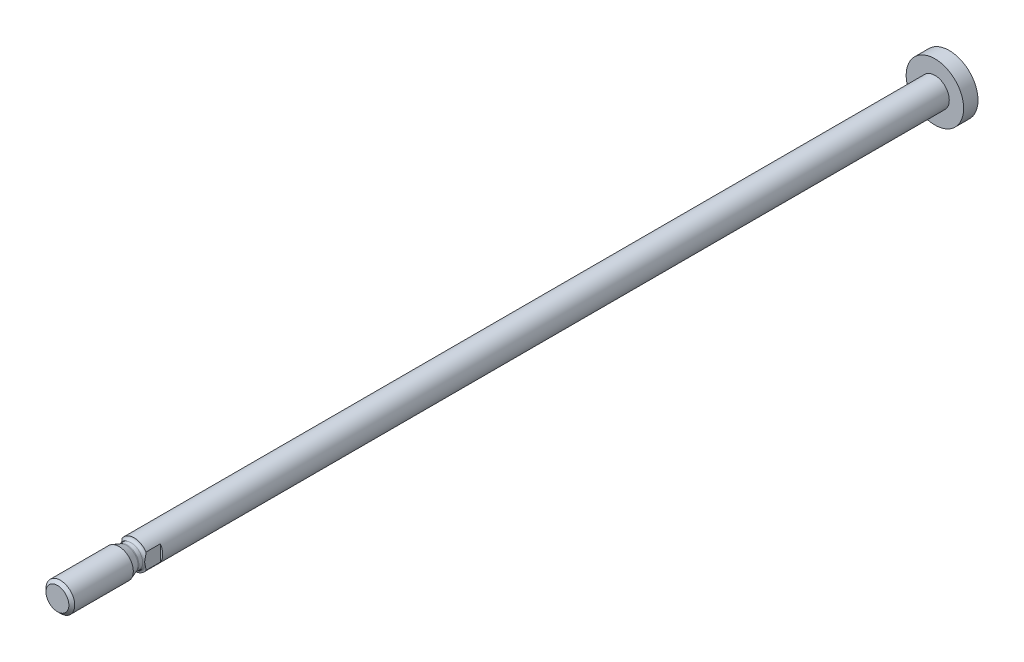
from build123d import *

# Parameters (mm, degrees)
SCHNITT_LINEAR_AUSTRAGEN1_DEPTH = 4


with BuildPart() as part:
    # Skizze1 → Rotation1 (revolve)
    with BuildSketch(Plane(origin=(0, 0, 0), x_dir=(0, 0, -1), z_dir=(1, 0, 0))):
        Polygon((-5, 0), (-5, 3), (162.3, 3), (162.3, 6), (165.3, 6), (165.3, 0), align=None)
    revolve(axis=Axis((0, 0, -165.3), (0, 0, 1)))

    # Skizze2 → Rotation2 (revolve)
    with BuildSketch(Plane(origin=(0, 0, 0), x_dir=(0, 0, -1), z_dir=(1, 0, 0))):
        with BuildLine():
            Line((-21, 0), (-21, 2.3865))
            Line((-21, 2.3865), (-20.3865, 3))
            Line((-20.3865, 3), (-8.148486452, 3))
            Line((-8.148486452, 3), (-6.599415898, 2.436184428))
            ThreePointArc((-6.599415898, 2.436184428), (-6.498392718, 2.409115348), (-6.394203812, 2.4))
            Line((-6.394203812, 2.4), (-5.6, 2.4))
            ThreePointArc((-5.6, 2.4), (-5.175735931, 2.575735931), (-5, 3))
            Line((-5, 3), (-4, 3))
            Line((-4, 3), (-4, 0))
            Line((-4, 0), (-21, 0))
        make_face()
    revolve(axis=Axis((0, 0, 4), (0, 0, 1)))

    # Skizze3 → Schnitt-Linear austragen1 (cut)
    with BuildSketch(Plane.XY.offset(2)):
        Polygon((-5, 10), (-5, -5), (-2.5, -5), (-2.5, 5), (2.5, 5), (2.5, -5), (5, -5), (5, 10), align=None)
    extrude(amount=SCHNITT_LINEAR_AUSTRAGEN1_DEPTH, mode=Mode.SUBTRACT)


solid = part.part
